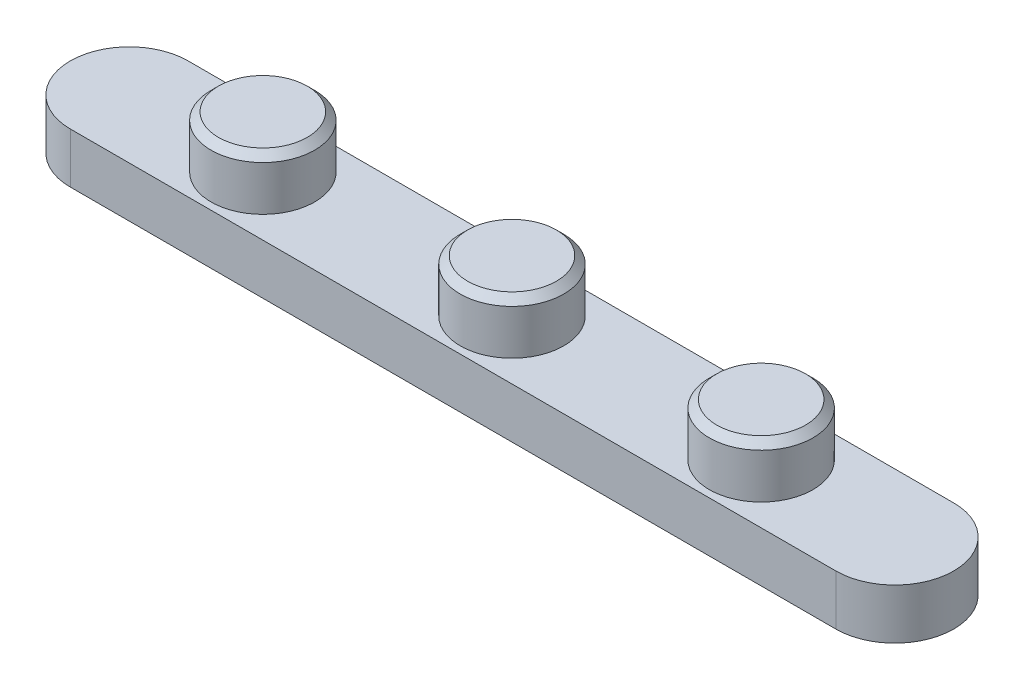
from build123d import *

# Parameters (mm, degrees)
BOSS_EXTRUDE1_DEPTH = 3.4
SKETCH1_3_R         = 3.5
BOSS_EXTRUDE2_DEPTH = 6.93
CHAMFER1_SIZE       = 0.5
SKETCH1_4_R         = 3.5
BOSS_EXTRUDE3_DEPTH = 6.93
CHAMFER2_SIZE       = 0.5


with BuildPart() as part:
    # Sketch1 → Boss-Extrude1 (new body)
    with BuildSketch(Plane(origin=(0, 0, 0), x_dir=(1, 0, 0), z_dir=(0, 1, 0))):
        with BuildLine():
            Line((-25.855, 3.98), (25.855, 3.98))
            ThreePointArc((25.855, 3.98), (29.835, 0), (25.855, -3.98))
            Line((25.855, -3.98), (-25.855, -3.98))
            ThreePointArc((-25.855, -3.98), (-29.835, 0), (-25.855, 3.98))
        make_face()
    extrude(amount=BOSS_EXTRUDE1_DEPTH)

    # Sketch1<3> → Boss-Extrude2 (add)
    with BuildSketch(Plane(origin=(0, 0, 0), x_dir=(1, 0, 0), z_dir=(0, 1, 0))):
        with Locations((-16.8275, 0)):
            Circle(SKETCH1_3_R)
        with Locations((16.8275, 0)):
            Circle(SKETCH1_3_R)
    extrude(amount=BOSS_EXTRUDE2_DEPTH)

    # Chamfer1
    chamfer1_edges = [part.edges().sort_by_distance(p)[0] for p in [
        (-20.3275, 6.93, 0),
        (13.3275, 6.93, 0),
    ]]
    chamfer(chamfer1_edges, length=CHAMFER1_SIZE)

    # Sketch1<4> → Boss-Extrude3 (add)
    with BuildSketch(Plane(origin=(0, 0, 0), x_dir=(1, 0, 0), z_dir=(0, 1, 0))):
        Circle(SKETCH1_4_R)
    extrude(amount=BOSS_EXTRUDE3_DEPTH)

    # Chamfer2
    chamfer2_edges = [part.edges().sort_by_distance(p)[0] for p in [
        (-3.5, 6.93, 0),
    ]]
    chamfer(chamfer2_edges, length=CHAMFER2_SIZE)


solid = part.part
